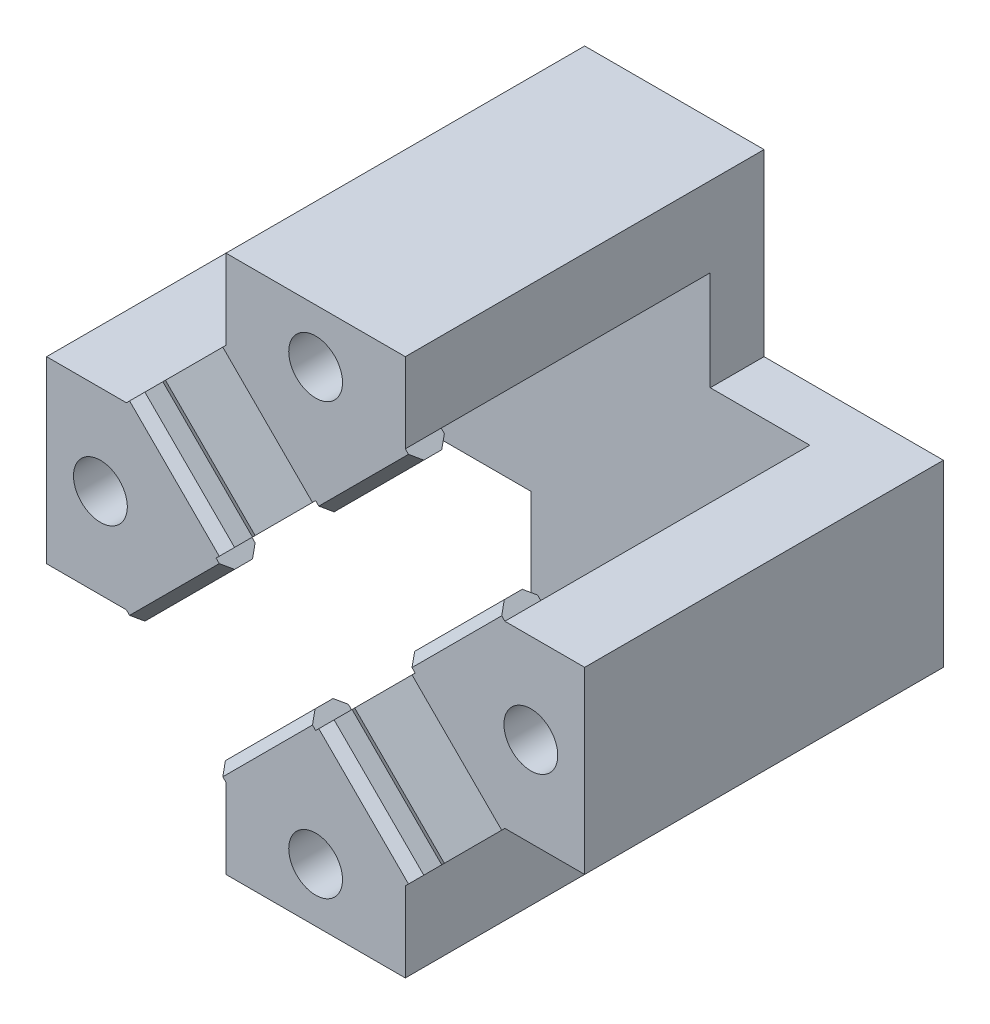
from build123d import *

# Parameters (mm, degrees)
BOSS_EXTRU_1_DEPTH           = 3
BOSS_EXTRU_2_DEPTH           = 17
ENL_V_MAT_EXTRU_1_DEPTH      = 33.739886985
ENL_V_MAT_EXTRU_1_DEPTH_BACK = 33.739886985
ESQUISSE3_R                  = 1.5
ESQUISSE4_W                  = 2
ESQUISSE4_H                  = 7.071067812
BOSS_EXTRU_3_DEPTH           = 0.75
ESQUISSE5_W                  = 2
ESQUISSE5_H                  = 7.071067812
BOSS_EXTRU_4_DEPTH           = 0.75
ESQUISSE6_W                  = 2
ESQUISSE6_H                  = 7.071067812
BOSS_EXTRU_5_DEPTH           = 0.75
ESQUISSE7_W                  = 2
ESQUISSE7_H                  = 7.071067812
BOSS_EXTRU_6_DEPTH           = 0.75
CHANFREIN1_SIZE              = 0.5


with BuildPart() as part:
    # Esquisse1 → Boss.-Extru.1 (new body)
    with BuildSketch(Plane.XY):
        Polygon((4.731002623, 9.053450907), (-5.268997377, 9.053450907), (-5.268997377, -0.946549093), (-15.268997377, -0.946549093), (-15.268997377, -10.946549093), (-5.268997377, -10.946549093), (-5.268997377, -20.946549093), (4.731002623, -20.946549093), (4.731002623, -10.946549093), (14.731002623, -10.946549093), (14.731002623, -0.946549093), (4.731002623, -0.946549093), align=None)
    extrude(amount=BOSS_EXTRU_1_DEPTH)

    # Esquisse2 → Boss.-Extru.2 (add)
    with BuildSketch(Plane.XY.offset(3)):
        Polygon((-5.268997377, 4.603450907), (-0.268997377, -0.396549093), (4.731002623, 4.603450907), (4.731002623, 9.053450907), (-5.268997377, 9.053450907), align=None)
        Polygon((4.731002623, -20.946549093), (4.731002623, -16.496549093), (-0.268997377, -11.496549093), (-5.268997377, -16.496549093), (-5.268997377, -20.946549093), align=None)
        Polygon((-10.818997377, -0.946549093), (-5.818997377, -5.946549093), (-10.818997377, -10.946549093), (-15.268997377, -10.946549093), (-15.268997377, -0.946549093), align=None)
        Polygon((5.281002623, -5.946549093), (10.281002623, -10.946549093), (14.731002623, -10.946549093), (14.731002623, -0.946549093), (10.281002623, -0.946549093), align=None)
    extrude(amount=BOSS_EXTRU_2_DEPTH)

    # Esquisse3 → Enlèv. mat.-Extru.1 (cut, two sides: drawn at the far end of the back side and taken through both)
    with BuildSketch(Plane(origin=(0, 0, 0), x_dir=(-1, 0, 0), z_dir=(0, 0, -1)).offset(-ENL_V_MAT_EXTRU_1_DEPTH_BACK)):
        with Locations((0.268997377, 6.053450907)):
            Circle(ESQUISSE3_R)
        with Locations((-11.731002623, -5.946549093)):
            Circle(ESQUISSE3_R)
        with Locations((12.268997377, -5.946549093)):
            Circle(ESQUISSE3_R)
        with Locations((0.268997377, -17.946549093)):
            Circle(ESQUISSE3_R)
    extrude(amount=ENL_V_MAT_EXTRU_1_DEPTH + ENL_V_MAT_EXTRU_1_DEPTH_BACK, mode=Mode.SUBTRACT)

    # Esquisse4 → Boss.-Extru.3 (add)
    with BuildSketch(Plane(origin=(-0.332773235, -0.332773235, 0), x_dir=(0, 0, 1), z_dir=(-0.7071067811865387, -0.7071067811865565, 0))):
        with Locations((19, 3.445341223)):
            Rectangle(ESQUISSE4_W, ESQUISSE4_H)
        with Locations((19, -11.47461186)):
            Rectangle(ESQUISSE4_W, ESQUISSE4_H)
    extrude(amount=BOSS_EXTRU_3_DEPTH)

    # Esquisse5 → Boss.-Extru.4 (add)
    with BuildSketch(Plane(origin=(-5.882773235, -5.882773235, 0), x_dir=(0, 0, -1), z_dir=(0.7071067811865489, 0.7071067811865461, 0))):
        with Locations((-19, 3.445341223)):
            Rectangle(ESQUISSE5_W, ESQUISSE5_H)
        with Locations((-19, -11.47461186)):
            Rectangle(ESQUISSE5_W, ESQUISSE5_H)
    extrude(amount=BOSS_EXTRU_4_DEPTH)

    # Esquisse6 → Boss.-Extru.5 (add)
    with BuildSketch(Plane(origin=(5.613775858, -5.613775858, 0), x_dir=(0, 0, 1), z_dir=(-0.7071067811865385, 0.7071067811865566, 0))):
        with Locations((19, -11.855031599)):
            Rectangle(ESQUISSE6_W, ESQUISSE6_H)
        with Locations((19, 3.064921484)):
            Rectangle(ESQUISSE6_W, ESQUISSE6_H)
    extrude(amount=BOSS_EXTRU_5_DEPTH)

    # Esquisse7 → Boss.-Extru.6 (add)
    with BuildSketch(Plane(origin=(0.063775858, -0.063775858, 0), x_dir=(0, 0, -1), z_dir=(0.7071067811865438, -0.7071067811865512, 0))):
        with Locations((-19, -11.855031599)):
            Rectangle(ESQUISSE7_W, ESQUISSE7_H)
        with Locations((-19, 3.064921484)):
            Rectangle(ESQUISSE7_W, ESQUISSE7_H)
    extrude(amount=BOSS_EXTRU_6_DEPTH)

    # Chanfrein1
    chanfrein1_edges = [part.edges().sort_by_distance(p)[0] for p in [
        (-3.299327463, -13.466219007, 18),
        (-3.299327463, -13.466219007, 20),
        (7.250672537, -2.916219007, 20),
        (7.250672537, -2.916219007, 18),
        (-7.788667291, -8.976879179, 18),
        (-7.788667291, -8.976879179, 20),
        (-7.788667291, -2.916219007, 18),
        (-7.788667291, -2.916219007, 20),
        (-3.299327463, 1.573120821, 18),
        (-3.299327463, 1.573120821, 20),
        (2.761332709, 1.573120821, 20),
        (2.761332709, 1.573120821, 18),
        (7.250672537, -8.976879179, 18),
        (7.250672537, -8.976879179, 20),
        (2.761332709, -13.466219007, 20),
        (2.761332709, -13.466219007, 18),
    ]]
    chamfer(chanfrein1_edges, length=CHANFREIN1_SIZE)


solid = part.part
